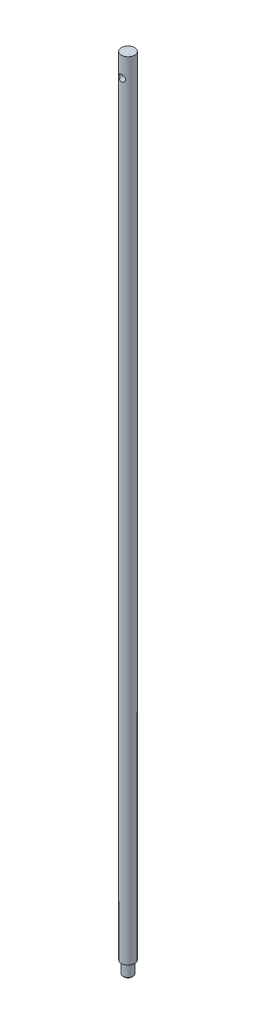
from build123d import *

# Parameters (mm, degrees)
CHAMFER1_SIZE           = 1.27
CUT_EXTRUDE1_DEPTH      = 769.402477547
CUT_EXTRUDE1_DEPTH_BACK = 769.402477547
SKETCH2_R               = 3.175


with BuildPart() as part:
    # Sketch1 → Revolve1 (revolve)
    with BuildSketch(Plane.XY):
        Polygon((0, 0), (0, 768.35), (-6.35, 768.35), (-6.35, 12.7), (-4.7625, 12.7), (-4.7625, 0), align=None)
    revolve(axis=Axis((0, 0, 0), (0, 1, 0)))

    # Chamfer1
    chamfer1_edges = [part.edges().sort_by_distance(p)[0] for p in [
        (4.7625, 0, 0),
    ]]
    chamfer(chamfer1_edges, length=CHAMFER1_SIZE)

    # Sketch2 → Cut-Extrude1 (cut, two sides: drawn at the far end of the back side and taken through both)
    with BuildSketch(Plane.XY.offset(-CUT_EXTRUDE1_DEPTH_BACK)):
        with Locations((0, 749.3)):
            Circle(SKETCH2_R)
    extrude(amount=CUT_EXTRUDE1_DEPTH + CUT_EXTRUDE1_DEPTH_BACK, mode=Mode.SUBTRACT)


solid = part.part
